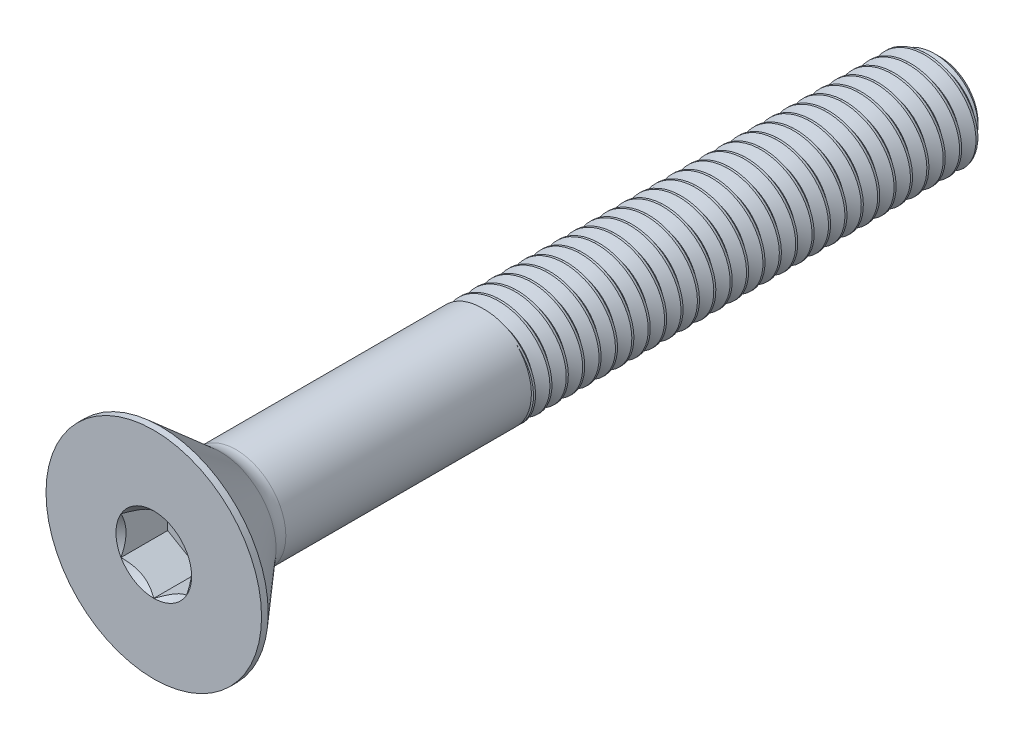
from build123d import *
from build123d.topology import SkipClean

# Parameters (mm, degrees)
SKETCH1_W           = 38.1
SKETCH1_H           = 2.413
CHAMFER1_SIZE       = 0.5953125
CUT_SWEEP1_PITCH    = 0.79375
CUT_EXTRUDE2_DEPTH  = 2.25806
BOSS_EXTRUDE2_START = -11.892364076
SKETCH9_R           = 2.413
BOSS_EXTRUDE2_DEPTH = 11.892364076


with BuildPart() as part:
    # Sketch1 → Revolve1 (revolve)
    with BuildSketch(Plane(origin=(0, 0, 0), x_dir=(0, 0, -1), z_dir=(1, 0, 0))):
        with Locations((19.05, 1.2065)):
            Rectangle(SKETCH1_W, SKETCH1_H)
    revolve(axis=Axis((0, 0, -38.1), (0, 0, 1)))

    # Chamfer1
    chamfer1_edges = [part.edges().sort_by_distance(p)[0] for p in [
        (0, -2.413, -38.1),
    ]]
    chamfer(chamfer1_edges, length=CHAMFER1_SIZE)

    # Cut-Sweep1: arcs per turn and ends read off the stored shape
    # Cut-Sweep1: the profile of Sketch2 profile screwed along a right-hand helix through 49 turns, 8 arcs to a turn; built about Z, then put on its axis
    cut_sweep1_z = Axis((0, 0, 0), (0, 0, 1))
    cut_sweep1_corners = [(2.4133, 0, 0.000173205), (2.4133, 0, -0.694704455), (1.897444252, 0, -0.396875), (1.897444252, 0, -0.29765625)]
    with BuildLine(mode=Mode.PRIVATE) as cut_sweep1_profile:
        Line(cut_sweep1_corners[0], cut_sweep1_corners[1])
        Line(cut_sweep1_corners[1], cut_sweep1_corners[2])
        Line(cut_sweep1_corners[2], cut_sweep1_corners[3])
        Line(cut_sweep1_corners[3], cut_sweep1_corners[0])
    cut_sweep1_cap = Face(cut_sweep1_profile.wire())
    cut_sweep1_turn_angles = [0, 22.5, 45, 67.5, 90, 112.5, 135, 157.5, 180, 202.5, 225, 247.5, 270, 292.5, 315, 337.5, 360]
    cut_sweep1_turn_weights = [1, 0.9238795325112867, 1, 0.9238795325112867, 1, 0.9238795325112867, 1, 0.9238795325112867, 1, 0.9238795325112867, 1, 0.9238795325112867, 1, 0.9238795325112867, 1, 0.9238795325112867, 1]
    cut_sweep1_turn_rails = [Edge.make_bspline([Vector(p[0], p[1], 0).rotate(cut_sweep1_z, cut_sweep1_turn_angles[k]) / cut_sweep1_turn_weights[k] + Vector(0, 0, p[2] + CUT_SWEEP1_PITCH * cut_sweep1_turn_angles[k] / 360) for k in range(17)], [0, 0, 0, 1, 1, 2, 2, 3, 3, 4, 4, 5, 5, 6, 6, 7, 7, 8, 8, 8], 2, cut_sweep1_turn_weights) for p in cut_sweep1_corners]
    cut_sweep1_turn_sides = [Face.make_surface_from_curves(cut_sweep1_turn_rails[p[0]], cut_sweep1_turn_rails[p[1]]) for p in [(0, 1), (1, 2), (2, 3), (3, 0)]]
    cut_sweep1 = Plane(origin=(0, 0, -38.1), x_dir=(0, 1, 0), z_dir=(0, 0, 1)) * Solid(Shell([*[p.moved(Location((0, 0, CUT_SWEEP1_PITCH * i))) for i in range(49) for p in cut_sweep1_turn_sides], cut_sweep1_cap, cut_sweep1_cap.rotate(cut_sweep1_z, 17640).moved(Location((0, 0, CUT_SWEEP1_PITCH * 17640 / 360)))]))
    add(cut_sweep1, mode=Mode.SUBTRACT)

    # Sketch7 → Revolve2 (revolve)
    with BuildSketch(Plane(origin=(0, 0, 0), x_dir=(0, 0, -1), z_dir=(1, 0, 0))):
        with BuildLine():
            Line((0, 5.2197), (0.32258, 5.2197))
            Line((0.32258, 5.2197), (3.2258, 2.695969357))
            ThreePointArc((3.2258, 2.695969357), (3.578633365, 2.486055564), (3.982635924, 2.413))
            Line((3.982635924, 2.413), (3.982635924, 0))
            Line((3.982635924, 0), (0, 0))
            Line((0, 0), (0, 5.2197))
        make_face()
    revolve(axis=Axis((0, 0, 0), (0, 0, -1)))

    # Boss-Extrude1 cone 1 section (through the dimple's axis) → Boss-Extrude1 (revolve)
    with BuildSketch(Plane(origin=(0, 0, -3.982635924), x_dir=(0, -1, 0), z_dir=(1, 0, 0))):
        Polygon((0, 0), (2.413, 0), (0, 2.413), align=None)
    revolve(axis=Axis((0, 0, -3.982635924), (0, 0, -1)))

    # Sketch5 → Cut-Extrude2 (cut)
    with BuildSketch(Plane.XY):
        Polygon((1.5875, -0.916543552), (1.5875, 0.916543552), (0, 1.833087105), (-1.5875, 0.916543552), (-1.5875, -0.916543552), (0, -1.833087105), align=None)
    extrude(amount=-CUT_EXTRUDE2_DEPTH, mode=Mode.SUBTRACT)

    # Cut-Extrude3 cone 1 section (through the dimple's axis) → Cut-Extrude3 (revolve, cut)
    with BuildSketch(Plane(origin=(0, 0, 0), x_dir=(0, -1, 0), z_dir=(1, 0, 0))):
        Polygon((0, 0), (1.833087105, 0), (0, 1.833087105), align=None)
    revolve(axis=Axis((0, 0, 0), (0, 0, -1)), mode=Mode.SUBTRACT)

    # Sketch9 → Boss-Extrude2 (add)
    with SkipClean():  # the faces are left unmerged after this step: merging them gives an invalid solid
        with BuildSketch(Plane.XY.offset(-3.982635924).offset(BOSS_EXTRUDE2_START)):
            with Locations(Location((0, 0, 0), (0, 0, 90))):
                Circle(SKETCH9_R)
        extrude(amount=BOSS_EXTRUDE2_DEPTH)


solid = part.part
